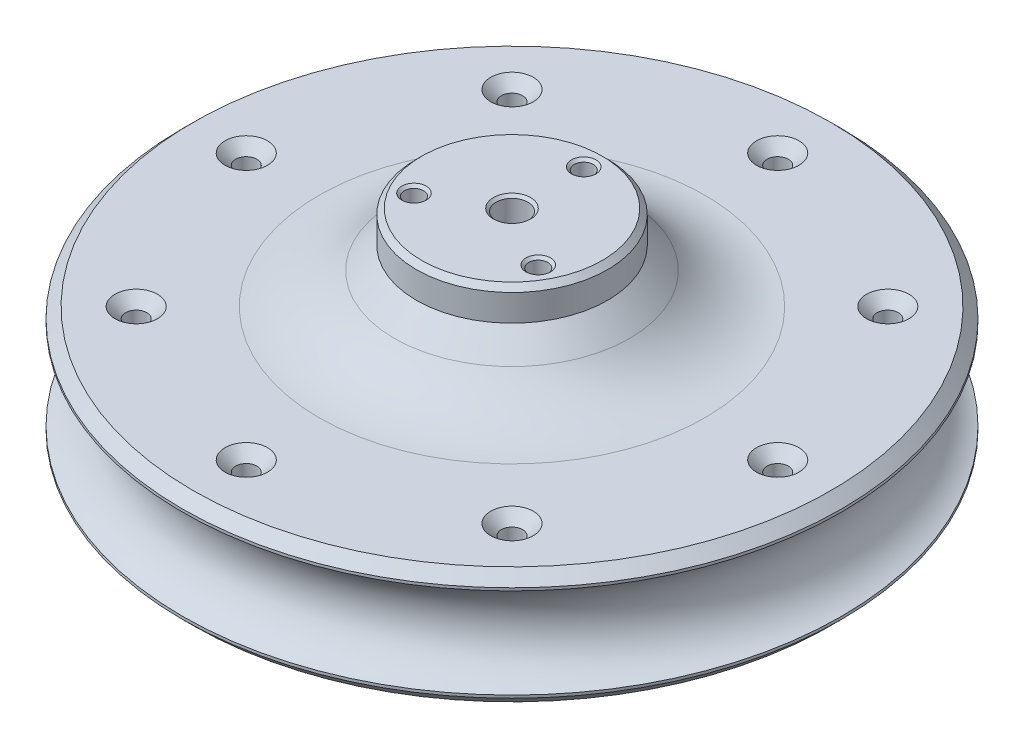
from build123d import *

# Parameters (mm, degrees)
SKETCH_1_R               = 62
EXTRUDE_1_DEPTH          = 22
SKETCH_3_R               = 9
CHAMFER_3_SIZE           = 2
CHAMFER_2_SIZE           = 2
SKETCH_4_R               = 18
EXTRUDE_2_DEPTH          = 16
CHAMFER_4_SIZE           = 10
FILLET_1_R               = 20
SKETCH_5_R               = 1.8
CUT_EXTRUDE_1_DEPTH      = 96.561498523
SKETCH_6_R               = 4
CUT_EXTRUDE_2_DEPTH      = 22
CHAMFER_5_SIZE           = 2.4
CHAMFER_6_SIZE           = 1
CHAMFER_7_SIZE           = 1
CUT_EXTRUDE_3_DEPTH      = 96.561498523
CUT_EXTRUDE_3_DEPTH_BACK = 96.561498523
SKETCH_7_R               = 2
SKETCH_7_R_2             = 3
CHAMFER_8_SIZE           = 2
CHAMFER_9_SIZE           = 0.5
CHAMFER_10_SIZE          = 1


with BuildPart() as part:
    # Эскиз1 → Бобышка-Вытянуть1 (new body)
    with BuildSketch(Plane(origin=(0, 0, 0), x_dir=(1, 0, 0), z_dir=(0, 1, 0))):
        with Locations(Location((0, 0, 0), (0, 0, 270))):
            Circle(SKETCH_1_R)
    extrude(amount=EXTRUDE_1_DEPTH)

    # Эскиз3 → Вырез-Повернуть2 (revolve, cut)
    with BuildSketch(Plane.XY, mode=Mode.PRIVATE) as cut_revolve_2_sk:
        with Locations((-65, 11)):
            Circle(SKETCH_3_R)
    revolve(cut_revolve_2_sk.sketch.rotate(Axis((0, 0, 0), (0, 1, 0)), 180), axis=Axis((0, 0, 0), (0, 1, 0)), mode=Mode.SUBTRACT)

    # Фаска3
    chamfer_3_edges = [part.edges().sort_by_distance(p)[0] for p in [
        (0, 0, -62),
    ]]
    chamfer(chamfer_3_edges, length=CHAMFER_3_SIZE)

    # Фаска2
    chamfer_2_edges = [part.edges().sort_by_distance(p)[0] for p in [
        (0, 22, -62),
    ]]
    chamfer(chamfer_2_edges, length=CHAMFER_2_SIZE)

    # Эскиз4 → Бобышка-Вытянуть2 (add)
    with BuildSketch(Plane(origin=(0, 22, 0), x_dir=(1, 0, 0), z_dir=(0, 1, 0))):
        with Locations(Location((0, 0, 0), (0, 0, 270))):
            Circle(SKETCH_4_R)
    extrude(amount=EXTRUDE_2_DEPTH)

    # Фаска4
    chamfer_4_edges = [part.edges().sort_by_distance(p)[0] for p in [
        (0, 22, -18),
    ]]
    chamfer(chamfer_4_edges, length=CHAMFER_4_SIZE)

    # Скругление1
    fillet_1_edges = [part.edges().sort_by_distance(p)[0] for p in [
        (0, 22, -28),
    ]]
    fillet(fillet_1_edges, radius=FILLET_1_R)

    # Эскиз5 → Вырез-Вытянуть1 (cut, through all)
    with BuildSketch(Plane(origin=(0, 38, 0), x_dir=(1, 0, 0), z_dir=(0, 1, 0))):
        with Locations(Location((0, 13.5, 0), (0, 0, 270))):
            Circle(SKETCH_5_R)
        with Locations(Location((11.691342951, -6.75, 0), (0, 0, 270))):
            Circle(SKETCH_5_R)
        with Locations(Location((-11.691342951, -6.75, 0), (0, 0, 270))):
            Circle(SKETCH_5_R)
    extrude(amount=-CUT_EXTRUDE_1_DEPTH, mode=Mode.SUBTRACT)

    # Эскиз6 → Вырез-Вытянуть2 (cut)
    with BuildSketch(Plane.XZ):
        with Locations(Location((0, -13.5, 0), (0, 0, 270))):
            Circle(SKETCH_6_R)
        with Locations(Location((11.691342951, 6.75, 0), (0, 0, 270))):
            Circle(SKETCH_6_R)
        with Locations(Location((-11.691342951, 6.75, 0), (0, 0, 270))):
            Circle(SKETCH_6_R)
    extrude(amount=-CUT_EXTRUDE_2_DEPTH, mode=Mode.SUBTRACT)

    # Фаска5
    # the kernel refuses this chamfer: 2.4 mm, written as the material it adds along each edge
    with BuildSketch(Plane(origin=(0, 22, -13.5), x_dir=(0, 0, -1), z_dir=(-1, 0, 0))) as chamfer_5_piece_1_section:
        Polygon((4 - CHAMFER_5_SIZE, 0), (4, CHAMFER_5_SIZE), (4, 0), align=None)
    chamfer_5_piece_1 = revolve(axis=Axis((0, 22, -13.5), (0, -1, 0)), mode=Mode.PRIVATE)
    chamfer_5_piece_1 = chamfer_5_piece_1 - Plane(origin=(0, 20.694254698, -13.5), x_dir=(0, 0, 1), z_dir=(0, 1, 0)) * Cylinder(1.8, 16, mode=Mode.PRIVATE)
    add(chamfer_5_piece_1)
    with BuildSketch(Plane(origin=(-11.691342951, 22, 6.75), x_dir=(0, 0, -1), z_dir=(-1, 0, 0))) as chamfer_5_piece_2_section:
        Polygon((4 - CHAMFER_5_SIZE, 0), (4, CHAMFER_5_SIZE), (4, 0), align=None)
    chamfer_5_piece_2 = revolve(axis=Axis((-11.691342951, 22, 6.75), (0, -1, 0)), mode=Mode.PRIVATE)
    chamfer_5_piece_2 = chamfer_5_piece_2 - Plane(origin=(-11.691342951, 20.694254698, 6.75), x_dir=(0, 0, 1), z_dir=(0, 1, 0)) * Cylinder(1.8, 17, mode=Mode.PRIVATE)
    add(chamfer_5_piece_2)
    with BuildSketch(Plane(origin=(11.691342951, 22, 6.75), x_dir=(0, 0, -1), z_dir=(-1, 0, 0))) as chamfer_5_piece_3_section:
        Polygon((4 - CHAMFER_5_SIZE, 0), (4, CHAMFER_5_SIZE), (4, 0), align=None)
    chamfer_5_piece_3 = revolve(axis=Axis((11.691342951, 22, 6.75), (0, -1, 0)), mode=Mode.PRIVATE)
    chamfer_5_piece_3 = chamfer_5_piece_3 - Plane(origin=(11.691342951, 20.694254698, 6.75), x_dir=(0, 0, 1), z_dir=(0, 1, 0)) * Cylinder(1.8, 17, mode=Mode.PRIVATE)
    add(chamfer_5_piece_3)

    # Фаска6
    chamfer_6_edges = [part.edges().sort_by_distance(p)[0] for p in [
        (0, 0, -9.5),
        (11.691342951, 0, 10.75),
        (-11.691342951, 0, 10.75),
    ]]
    chamfer(chamfer_6_edges, length=CHAMFER_6_SIZE)

    # Фаска7
    chamfer_7_edges = [part.edges().sort_by_distance(p)[0] for p in [
        (0, 38, -18),
    ]]
    chamfer(chamfer_7_edges, length=CHAMFER_7_SIZE)

    # Эскиз7 → Вырез-Вытянуть3 (cut, two sides: drawn at the far end of the back side and taken through both)
    with BuildSketch(Plane(origin=(0, 38, 0), x_dir=(1, 0, 0), z_dir=(0, 1, 0)).offset(-CUT_EXTRUDE_3_DEPTH_BACK)):
        with Locations(Location((0, 50, 0), (0, 0, 270))):
            Circle(SKETCH_7_R)
        with Locations(Location((35.355339059, 35.355339059, 0), (0, 0, 270))):
            Circle(SKETCH_7_R)
        with Locations(Location((50, 0, 0), (0, 0, 270))):
            Circle(SKETCH_7_R)
        with Locations(Location((35.355339059, -35.355339059, 0), (0, 0, 270))):
            Circle(SKETCH_7_R)
        with Locations(Location((0, -50, 0), (0, 0, 270))):
            Circle(SKETCH_7_R)
        with Locations(Location((-35.355339059, -35.355339059, 0), (0, 0, 270))):
            Circle(SKETCH_7_R)
        with Locations(Location((-50, 0, 0), (0, 0, 270))):
            Circle(SKETCH_7_R)
        with Locations(Location((-35.355339059, 35.355339059, 0), (0, 0, 270))):
            Circle(SKETCH_7_R)
        with Locations(Location((0, 0, 0), (0, 0, 270))):
            Circle(SKETCH_7_R_2)
    extrude(amount=CUT_EXTRUDE_3_DEPTH + CUT_EXTRUDE_3_DEPTH_BACK, mode=Mode.SUBTRACT)

    # Фаска8
    chamfer_8_edges = [part.edges().sort_by_distance(p)[0] for p in [
        (-35.355339059, 22, 33.355339059),
        (0, 22, 48),
        (35.355339059, 22, -37.355339059),
        (50, 22, -2),
        (35.355339059, 22, 33.355339059),
        (0, 22, -52),
        (-35.355339059, 22, -37.355339059),
        (-50, 22, -2),
    ]]
    chamfer(chamfer_8_edges, length=CHAMFER_8_SIZE)

    # Фаска9
    chamfer_9_edges = [part.edges().sort_by_distance(p)[0] for p in [
        (0, 38, -3),
        (0, 38, -15.3),
        (11.691342951, 38, 4.95),
        (-11.691342951, 38, 4.95),
    ]]
    chamfer(chamfer_9_edges, length=CHAMFER_9_SIZE)

    # Фаска10
    chamfer_10_edges = [part.edges().sort_by_distance(p)[0] for p in [
        (-35.355339059, 0, 33.355339059),
        (0, 0, 48),
        (0, 0, -3),
        (35.355339059, 0, -37.355339059),
        (50, 0, -2),
        (35.355339059, 0, 33.355339059),
        (0, 0, -52),
        (-35.355339059, 0, -37.355339059),
        (-50, 0, -2),
    ]]
    chamfer(chamfer_10_edges, length=CHAMFER_10_SIZE)


solid = part.part
